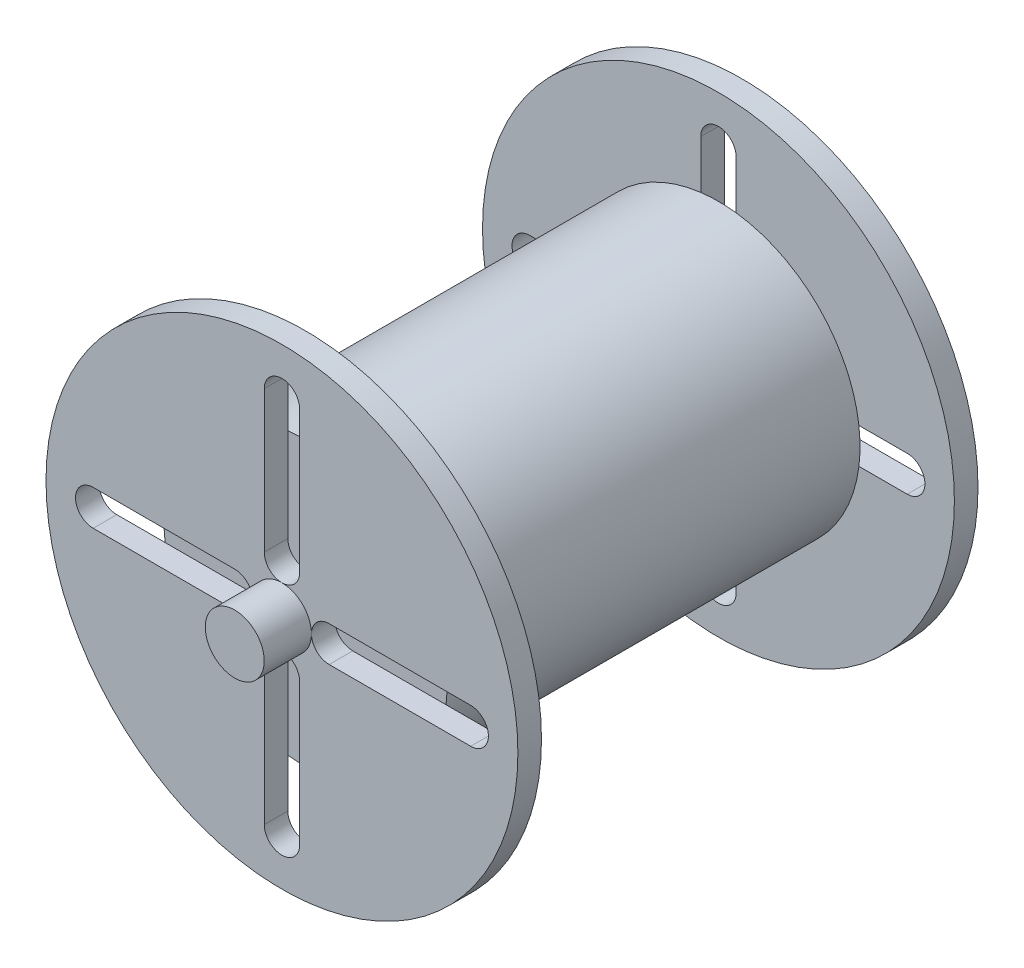
from build123d import *

# Parameters (mm, degrees)
SKETCH1_R           = 60
BOSS_EXTRUDE1_DEPTH = 87.5
SKETCH2_R           = 100
BOSS_EXTRUDE2_DEPTH = 10
SKETCH3_R           = 12.5
BOSS_EXTRUDE3_DEPTH = 20


with BuildPart() as part:
    # Sketch1 → Boss-Extrude1 (new, symmetric)
    with BuildSketch(Plane.XY):
        Circle(SKETCH1_R)
    extrude(amount=BOSS_EXTRUDE1_DEPTH, both=True)

    # Sketch2 → Boss-Extrude2 (add)
    with BuildSketch(Plane.XY.offset(87.5)):
        Circle(SKETCH2_R)
        with BuildLine():
            Line((7.5, 80), (7.5, 20))
            ThreePointArc((7.5, 20), (0, 12.5), (-7.5, 20))
            Line((-7.5, 20), (-7.5, 80))
            ThreePointArc((-7.5, 80), (0, 87.5), (7.5, 80))
        make_face(mode=Mode.SUBTRACT)
        with BuildLine():
            Line((80, 7.5), (20, 7.5))
            ThreePointArc((20, 7.5), (12.5, 0), (20, -7.5))
            Line((20, -7.5), (80, -7.5))
            ThreePointArc((80, -7.5), (87.5, 0), (80, 7.5))
        make_face(mode=Mode.SUBTRACT)
        with BuildLine():
            Line((7.5, -80), (7.5, -20))
            ThreePointArc((7.5, -20), (0, -12.5), (-7.5, -20))
            Line((-7.5, -20), (-7.5, -80))
            ThreePointArc((-7.5, -80), (0, -87.5), (7.5, -80))
        make_face(mode=Mode.SUBTRACT)
        with BuildLine():
            Line((-80, -7.5), (-20, -7.5))
            ThreePointArc((-20, -7.5), (-12.5, 0), (-20, 7.5))
            Line((-20, 7.5), (-80, 7.5))
            ThreePointArc((-80, 7.5), (-87.5, 0), (-80, -7.5))
        make_face(mode=Mode.SUBTRACT)
    boss_extrude2 = extrude(amount=BOSS_EXTRUDE2_DEPTH)

    # Sketch3 → Boss-Extrude3 (add)
    with BuildSketch(Plane.XY.offset(97.5)):
        Circle(SKETCH3_R)
    boss_extrude3 = extrude(amount=BOSS_EXTRUDE3_DEPTH)

    # Mirror1: Boss-Extrude2 across plane
    add(boss_extrude2.mirror(Plane.XY))

    # Mirror2: Boss-Extrude3 across plane
    add(boss_extrude3.mirror(Plane.XY))


solid = part.part
